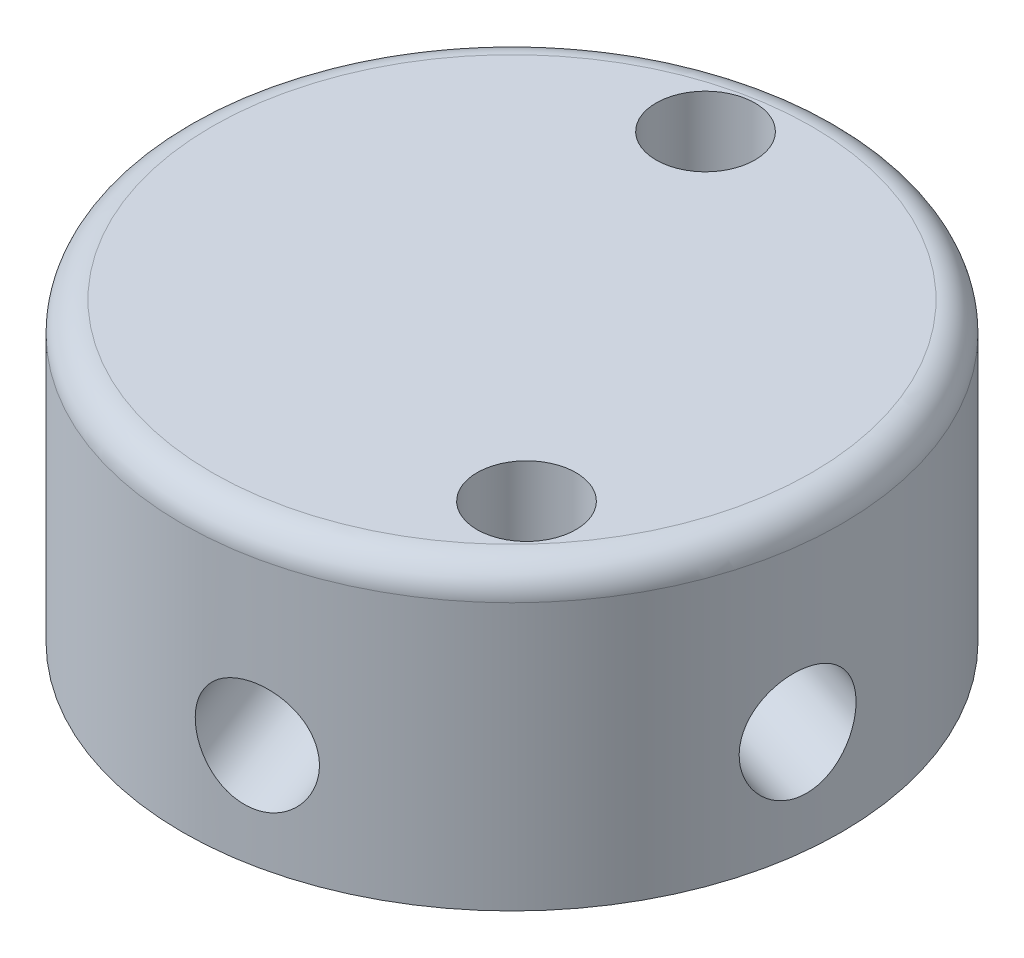
from build123d import *

# Parameters (mm, degrees)
BOSS_EXTRUDE1_DEPTH      = 3
BOSS_EXTRUDE1_DEPTH_BACK = 6
SKETCH1_R                = 10
SKETCH4_R                = 1.6
HOLE_DEPTH               = 19.539009706
HOLECIR_COUNT            = 5
FILLET3_R                = 0.9
SKETCH5_R                = 3.5
CUT_EXTRUDE1_DEPTH       = 2.6
SKETCH6_R                = 1.5
CUT_EXTRUDE2_DEPTH       = 17.763054787


with BuildPart() as part:
    # Sketch1 → Boss-Extrude1 (new, two sides: drawn at the far end of the back side and taken through both)
    with BuildSketch(Plane(origin=(0, 0, 0), x_dir=(1, 0, 0), z_dir=(0, 1, 0)).offset(-BOSS_EXTRUDE1_DEPTH_BACK)):
        Circle(SKETCH1_R)
    extrude(amount=BOSS_EXTRUDE1_DEPTH + BOSS_EXTRUDE1_DEPTH_BACK)

    # Sketch4 → hole (cut, through all)
    with BuildSketch(Plane(origin=(-3.352872105, -1.093066116, 1.887711608), x_dir=(-0.4486862613641547, -0.14627571033740308, -0.8816371449912632), z_dir=(0.8382180262940947, 0.2732665289126682, -0.47192790187872385))):
        Circle(SKETCH4_R)
    hole = extrude(amount=-HOLE_DEPTH, mode=Mode.SUBTRACT)

    # holecir: hole ×5 about axis
    holecir_axis = Axis((0, 5.5, 0), (0, -1, 0))
    for i in range(1, HOLECIR_COUNT):
        add(hole.rotate(holecir_axis, i * 360 / HOLECIR_COUNT), mode=Mode.SUBTRACT)

    # Fillet3
    fillet3_edges = [part.edges().sort_by_distance(p)[0] for p in [
        (-10, 3, 0),
    ]]
    fillet(fillet3_edges, radius=FILLET3_R)

    # Sketch5 → Cut-Extrude1 (cut)
    with BuildSketch(Plane.XZ.offset(6)):
        Circle(SKETCH5_R)
    extrude(amount=-CUT_EXTRUDE1_DEPTH, mode=Mode.SUBTRACT)

    # Sketch6 → Cut-Extrude2 (cut, through all)
    with BuildSketch(Plane(origin=(0, 3, 0), x_dir=(1, 0, 0), z_dir=(0, 1, 0))):
        with Locations((-1.479875163, 7.352548504)):
            Circle(SKETCH6_R)
        with Locations((5.518963734, -5.078487896)):
            Circle(SKETCH6_R)
    extrude(amount=-CUT_EXTRUDE2_DEPTH, mode=Mode.SUBTRACT)


solid = part.part
